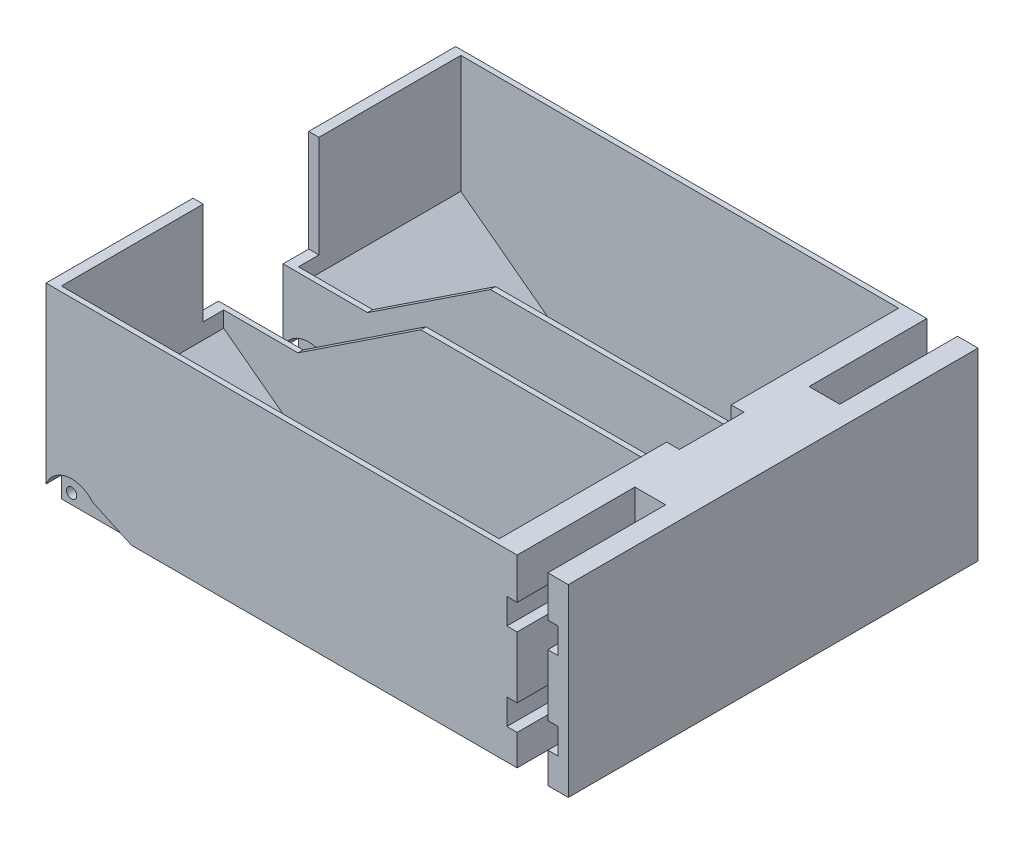
from build123d import *

# Parameters (mm, degrees)
SKETCH2_W            = 89.5
SKETCH2_H            = 33.7
BOSS_EXTRUDE1_DEPTH  = 38
SKETCH3_W            = 85.5
SKETCH3_H            = 31.7
CUT_EXTRUDE1_DEPTH   = 38
BOSS_EXTRUDE2_DEPTH  = 31.7
SKETCH5_W            = 33.7
SKETCH5_H            = 38
BOSS_EXTRUDE3_DEPTH  = 2.5
SKETCH6_W            = 2
SKETCH6_H            = 38
BOSS_EXTRUDE4_DEPTH  = 6.3
SKETCH7_W            = 34
SKETCH7_H            = 38
BOSS_EXTRUDE5_DEPTH  = 10
SKETCH8_W            = 4
SKETCH8_H            = 38
BOSS_EXTRUDE6_DEPTH  = 23
CUT_EXTRUDE2_START   = -32.7
SKETCH9_W            = 10
SKETCH9_H            = 5
CUT_EXTRUDE2_DEPTH   = 32.7
SKETCH11_W           = 80
SKETCH11_H           = 2
CUT_EXTRUDE3_DEPTH   = 80
CUT_EXTRUDE4_DEPTH   = 3
MIRROR4_COPY_1_DEPTH = 3
CUT_EXTRUDE5_START   = -74
SKETCH13_R           = 1
CUT_EXTRUDE5_DEPTH   = 74
SKETCH15_W           = 47
SKETCH15_H           = 1
CUT_EXTRUDE6_DEPTH   = 4
SKETCH16_W           = 40.5
SKETCH16_H           = 2
CUT_EXTRUDE7_DEPTH   = 19.9
SKETCH17_W           = 2
SKETCH17_H           = 19.9
CUT_EXTRUDE8_DEPTH   = 3
BOSS_EXTRUDE7_START  = -1
BOSS_EXTRUDE7_DEPTH  = 1


with BuildPart() as part:
    # Sketch2 → Boss-Extrude1 (new body)
    with BuildSketch(Plane(origin=(0, 0, 0), x_dir=(1, 0, 0), z_dir=(0, 1, 0))):
        Rectangle(SKETCH2_W, SKETCH2_H)
    extrude(amount=BOSS_EXTRUDE1_DEPTH)

    # Sketch3 → Cut-Extrude1 (cut)
    with BuildSketch(Plane(origin=(0, 38, 0), x_dir=(1, 0, 0), z_dir=(0, 1, 0))):
        Rectangle(SKETCH3_W, SKETCH3_H)
    extrude(amount=-CUT_EXTRUDE1_DEPTH, mode=Mode.SUBTRACT)

    # Sketch4 → Boss-Extrude2 (add)
    with BuildSketch(Plane.XY.offset(-15.85)):
        Polygon((-42.75, 0), (-42.75, 15), (-22.75, 0), align=None)
    extrude(amount=BOSS_EXTRUDE2_DEPTH)

    # Sketch5 → Boss-Extrude3 (add)
    with BuildSketch(Plane(origin=(44.75, 0, 0), x_dir=(0, 0, -1), z_dir=(1, 0, 0))):
        with Locations((0, 19)):
            Rectangle(SKETCH5_W, SKETCH5_H)
    extrude(amount=BOSS_EXTRUDE3_DEPTH)

    # Sketch6 → Boss-Extrude4 (add)
    with BuildSketch(Plane(origin=(0, 0, -16.85), x_dir=(-1, 0, 0), z_dir=(0, 0, -1))):
        with Locations((-46.25, 19)):
            Rectangle(SKETCH6_W, SKETCH6_H)
    extrude(amount=BOSS_EXTRUDE4_DEPTH)

    # Mirror1: part across plane


with BuildPart() as part_1:
    add(part.part)
    add(part.part.mirror(Plane(origin=(0, 0, -23.15), x_dir=(1, 0, 0), z_dir=(0, 0, -1))))

    # Sketch7 → Boss-Extrude5 (add)
    with BuildSketch(Plane(origin=(47.25, 0, 0), x_dir=(0, 0, -1), z_dir=(1, 0, 0))):
        with Locations((23.15, 19)):
            Rectangle(SKETCH7_W, SKETCH7_H)
    extrude(amount=BOSS_EXTRUDE5_DEPTH)

    # Sketch8 → Boss-Extrude6 (add)
    with BuildSketch(Plane.XY.offset(-6.15)):
        with Locations((55.25, 19)):
            Rectangle(SKETCH8_W, SKETCH8_H)
    boss_extrude6 = extrude(amount=BOSS_EXTRUDE6_DEPTH)

    # Sketch9 → Cut-Extrude2 (cut)
    with BuildSketch(Plane.XY.offset(16.85).offset(CUT_EXTRUDE2_START)):
        with Locations((50.25, 27.5)):
            Rectangle(SKETCH9_W, SKETCH9_H)
        with Locations((50.25, 10.5)):
            Rectangle(SKETCH9_W, SKETCH9_H)
    cut_extrude2 = extrude(amount=CUT_EXTRUDE2_DEPTH, mode=Mode.SUBTRACT)

    # Mirror2: Boss-Extrude6, Cut-Extrude2 across plane
    add(boss_extrude6.mirror(Plane(origin=(0, 0, -23.15), x_dir=(1, 0, 0), z_dir=(0, 0, -1))))
    add(cut_extrude2.mirror(Plane(origin=(0, 0, -23.15), x_dir=(1, 0, 0), z_dir=(0, 0, -1))), mode=Mode.SUBTRACT)

    # Sketch11 → Cut-Extrude3 (cut)
    with BuildSketch(Plane(origin=(57.25, 0, 0), x_dir=(0, 0, -1), z_dir=(1, 0, 0))):
        with Locations((23.15, 1)):
            Rectangle(SKETCH11_W, SKETCH11_H)
    extrude(amount=-CUT_EXTRUDE3_DEPTH, mode=Mode.SUBTRACT)

    # Sketch12 → Cut-Extrude4 (cut)
    with BuildSketch(Plane.XY.offset(16.85)):
        with BuildLine():
            Line((-22.75, 2), (-34.364835193, 2))
            ThreePointArc((-34.364835193, 2), (-40.768375168, 7.287996976), (-44.75, 0))
            Line((-44.75, 0), (-22.75, 0))
            Line((-22.75, 0), (-22.75, 2))
        make_face()
    cut_extrude4 = extrude(amount=-CUT_EXTRUDE4_DEPTH, mode=Mode.SUBTRACT)

    # Mirror3: Cut-Extrude4 across plane
    add(cut_extrude4.mirror(Plane.XY), mode=Mode.SUBTRACT)

    # Mirror4: Cut-Extrude4 across plane
    add(cut_extrude4.mirror(Plane(origin=(0, 0, -23.15), x_dir=(1, 0, 0), z_dir=(0, 0, -1))), mode=Mode.SUBTRACT)

    # Mirror4 copy 1 sketch → Mirror4 copy 1 (cut)
    with BuildSketch(Plane.XY.offset(-29.45)):
        with BuildLine():
            Line((-22.75, 2), (-34.364835193, 2))
            ThreePointArc((-34.364835193, 2), (-40.768375168, 7.287996976), (-44.75, 0))
            Line((-44.75, 0), (-22.75, 0))
            Line((-22.75, 0), (-22.75, 2))
        make_face()
    extrude(amount=-MIRROR4_COPY_1_DEPTH, mode=Mode.SUBTRACT)

    # Sketch13 → Cut-Extrude5 (cut)
    with BuildSketch(Plane.XY.offset(13.85).offset(CUT_EXTRUDE5_START)):
        with Locations((-42.75, 2)):
            Circle(SKETCH13_R)
    extrude(amount=CUT_EXTRUDE5_DEPTH, mode=Mode.SUBTRACT)

    # Chamfer1
    # the kernel refuses this chamfer: 10 mm, written as the material it takes off along each edge
    with BuildSketch(Plane(origin=(-34.364835193, 2, 33.530669666), x_dir=(-0.4115208033655663, 0.9114003666870882, 0), z_dir=(0, 0, -1))) as chamfer1_piece_1:
        with BuildLine():
            Line((4.024103798, 0), (-2.897424879, 6.010331734))
            Line((-2.897424879, 6.010331734), (-3.079704953, 5.928027573))
            ThreePointArc((-3.079704953, 5.928027573), (-1.554736759, 2.957293148), (-0.182280073, -0.082304161))
            Line((-0.182280073, -0.082304161), (0.082304161, -0.182280073))
            ThreePointArc((0.082304161, -0.182280073), (2.000716354, 0.27264804), (3.968173362, -0.192020276))
            Line((3.968173362, -0.192020276), (4.024103798, 0))
        make_face()
    extrude(amount=19.680669666, mode=Mode.SUBTRACT)

    # Chamfer2
    # the kernel refuses this chamfer: 10 mm, written as the material it takes off along each edge
    with BuildSketch(Plane(origin=(-34.364835193, 2, -33.530669666), x_dir=(0.9996854583228201, -0.025079561756403367, 0), z_dir=(0, 0, 1))) as chamfer2_piece_1_section:
        with BuildLine():
            Line((6.304869905, 0.158173126), (-1.380064624, 3.466711132))
            ThreePointArc((-1.380064624, 3.466711132), (-0.439598609, 1.999919309), (0, 0))
            Line((0, 0), (6.304869905, 0.158173126))
        make_face()
    chamfer2_piece_1 = extrude(amount=19.680669666, mode=Mode.PRIVATE)
    chamfer2_piece_1 = split(chamfer2_piece_1, bisect_by=Plane(origin=(-32.514060805, 3.115216655, -29.45), z_dir=(0, 0, 1)), keep=Keep.TOP, mode=Mode.PRIVATE)
    add(chamfer2_piece_1, mode=Mode.SUBTRACT)

    # Chamfer3
    # the kernel refuses this chamfer: 10 mm, written as the material it takes off along each edge
    with BuildSketch(Plane(origin=(-34.364835193, 2, -12.769330334), x_dir=(-0.4115208033655663, 0.9114003666870882, 0), z_dir=(0, 0, -1))) as chamfer3_piece_1_section:
        with BuildLine():
            Line((4.024103798, 0), (-2.897424879, 6.010331734))
            Line((-2.897424879, 6.010331734), (-3.079704953, 5.928027573))
            ThreePointArc((-3.079704953, 5.928027573), (-1.554736759, 2.957293148), (-0.182280073, -0.082304161))
            Line((-0.182280073, -0.082304161), (0.082304161, -0.182280073))
            ThreePointArc((0.082304161, -0.182280073), (2.000716354, 0.27264804), (3.968173362, -0.192020276))
            Line((3.968173362, -0.192020276), (4.024103798, 0))
        make_face()
    chamfer3_piece_1 = extrude(amount=19.680669666, mode=Mode.PRIVATE)
    chamfer3_piece_1 = split(chamfer3_piece_1, bisect_by=Plane(origin=(-32.482113907, 3.03712607, -13.85), z_dir=(0, 0, -1)), keep=Keep.TOP, mode=Mode.PRIVATE)
    add(chamfer3_piece_1, mode=Mode.SUBTRACT)

    # Chamfer4
    # the kernel refuses this chamfer: 10 mm, written as the material it takes off along each edge
    with BuildSketch(Plane(origin=(-34.364835193, 2, -79.830669666), x_dir=(0.9996854583228201, -0.025079561756403367, 0), z_dir=(0, 0, 1))) as chamfer4_piece_1:
        with BuildLine():
            Line((6.672267866, 0), (-1.747462586, 3.624884258))
            Line((-1.747462586, 3.624884258), (-1.896145364, 3.491117927))
            ThreePointArc((-1.896145364, 3.491117927), (-0.623209418, 1.920628258), (-0.199937092, -0.005015912))
            Line((-0.199937092, -0.005015912), (0.005015912, -0.199937092))
            ThreePointArc((0.005015912, -0.199937092), (3.339051469, -0.116294632), (6.677283779, -0.199937092))
            Line((6.677283779, -0.199937092), (6.672267866, 0))
        make_face()
    extrude(amount=19.680669666, mode=Mode.SUBTRACT)

    # Sketch15 → Cut-Extrude6 (cut)
    with BuildSketch(Plane(origin=(0, 38, 0), x_dir=(1, 0, 0), z_dir=(0, 1, 0))):
        with Locations((19.25, 16.35)):
            Rectangle(SKETCH15_W, SKETCH15_H)
    cut_extrude6 = extrude(amount=-CUT_EXTRUDE6_DEPTH, mode=Mode.SUBTRACT)

    # Sketch16 → Cut-Extrude7 (cut)
    with BuildSketch(Plane(origin=(0, 38, 0), x_dir=(1, 0, 0), z_dir=(0, 1, 0))):
        with Locations((-24.5, 15.85)):
            Rectangle(SKETCH16_W, SKETCH16_H)
    cut_extrude7 = extrude(amount=-CUT_EXTRUDE7_DEPTH, mode=Mode.SUBTRACT)

    # Sketch17 → Cut-Extrude8 (cut)
    with BuildSketch(Plane(origin=(0, 0, -14.85), x_dir=(-1, 0, 0), z_dir=(0, 0, -1))):
        with Locations((43.75, 28.05)):
            Rectangle(SKETCH17_W, SKETCH17_H)
    cut_extrude8 = extrude(amount=-CUT_EXTRUDE8_DEPTH, mode=Mode.SUBTRACT)

    # Sketch18 → Boss-Extrude7 (add)
    with BuildSketch(Plane.XY.offset(-15.85).offset(BOSS_EXTRUDE7_START)):
        Polygon((-4.25, 18.1), (-4.25, 34), (-28.25, 18.1), align=None)
    boss_extrude7 = extrude(amount=BOSS_EXTRUDE7_DEPTH)

    # Mirror5: Cut-Extrude6, Cut-Extrude7, Cut-Extrude8, Boss-Extrude7 across plane
    add(cut_extrude6.mirror(Plane(origin=(0, 0, -23.15), x_dir=(1, 0, 0), z_dir=(0, 0, -1))), mode=Mode.SUBTRACT)
    add(cut_extrude7.mirror(Plane(origin=(0, 0, -23.15), x_dir=(1, 0, 0), z_dir=(0, 0, -1))), mode=Mode.SUBTRACT)
    add(cut_extrude8.mirror(Plane(origin=(0, 0, -23.15), x_dir=(1, 0, 0), z_dir=(0, 0, -1))), mode=Mode.SUBTRACT)
    add(boss_extrude7.mirror(Plane(origin=(0, 0, -23.15), x_dir=(1, 0, 0), z_dir=(0, 0, -1))))


solid = part_1.part
